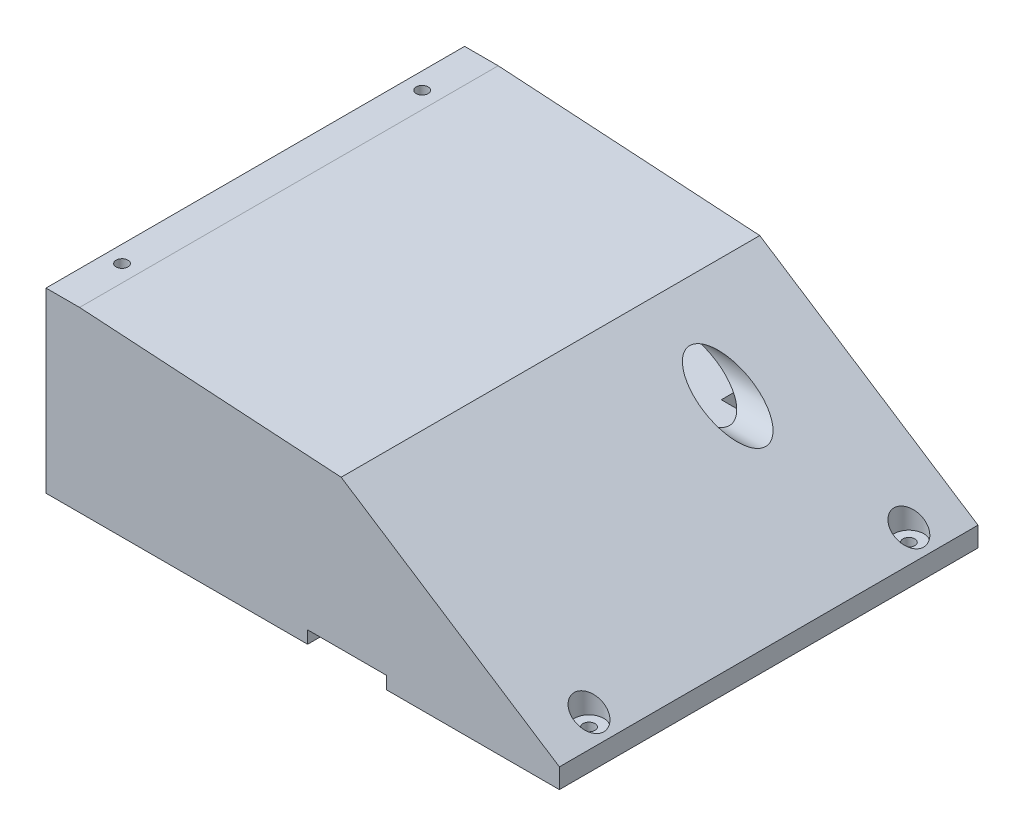
from build123d import *

# Parameters (mm, degrees)
BOSS_EXTRUDE1_DEPTH     = 212
BOSS_EXTRUDE2_DEPTH     = 10
BOSS_EXTRUDE3_DEPTH     = 10
SKETCH4_R               = 3
CUT_EXTRUDE1_DEPTH      = 348.338451658
SKETCH6_R               = 7.5
CUT_EXTRUDE2_DEPTH      = 345.882588717
SKETCH7_R               = 1.5
SKETCH7_R_2             = 12.5
SKETCH7_W               = 10
SKETCH7_H               = 120
SKETCH7_W_2             = 60
SKETCH7_H_2             = 15
CUT_EXTRUDE3_DEPTH      = 12.5
CUT_EXTRUDE4_REACH      = 276.574
SKETCH8_R               = 12.5
CUT_EXTRUDE5_DEPTH      = 342.714793358
CUT_EXTRUDE5_DEPTH_BACK = 342.714793358
SKETCH9_R               = 3
CUT_EXTRUDE6_DEPTH      = 348.338451658
CUT_EXTRUDE6_DEPTH_BACK = 348.338451658
SKETCH10_W              = 40
SKETCH10_H              = 6.35


with BuildPart() as part:
    # Sketch1 → Boss-Extrude1 (new body)
    with BuildSketch(Plane.XY):
        Polygon((0, 0), (-20, 0), (-20, 20), (-242.984559153, 20), (-242.984559153, 25), (-260, 25), (-260, 30), (-49.158083864, 30), (-122.301669645, 77.5), (-242.984559153, 85), (-260, 85), (-260, 90), (-242.984559153, 90), (-110.511971445, 81.767313396), (0, 10), align=None)
    extrude(amount=BOSS_EXTRUDE1_DEPTH)

    # Sketch2 → Boss-Extrude2 (add)
    with BuildSketch(Plane(origin=(0, 0, 0), x_dir=(-1, 0, 0), z_dir=(0, 0, -1))):
        Polygon((0, 0), (260, 0), (260, 90), (110.511971445, 81.767313396), (0, 10), align=None)
    extrude(amount=-BOSS_EXTRUDE2_DEPTH)

    # Sketch3 → Boss-Extrude3 (add)
    with BuildSketch(Plane.XY.offset(212)):
        Polygon((-110.511971445, 81.767313396), (0, 10), (0, 0), (-260, 0), (-260, 90), align=None)
    extrude(amount=-BOSS_EXTRUDE3_DEPTH)

    # Sketch4 → Cut-Extrude1 (cut, through all)
    with BuildSketch(Plane.XZ):
        with Locations((-10, 187)):
            Circle(SKETCH4_R)
        with Locations((-10, 25)):
            Circle(SKETCH4_R)
    extrude(amount=-CUT_EXTRUDE1_DEPTH, mode=Mode.SUBTRACT)

    # Sketch6 → Cut-Extrude2 (cut, through all)
    with BuildSketch(Plane(origin=(0, 10, 0), x_dir=(-1, 0, 0), z_dir=(0, -1, 0))):
        with Locations((10, -25)):
            Circle(SKETCH6_R)
        with Locations((10, -187)):
            Circle(SKETCH6_R)
    extrude(amount=-CUT_EXTRUDE2_DEPTH, mode=Mode.SUBTRACT)

    # Sketch7 → Cut-Extrude3 (cut)
    with BuildSketch(Plane.XZ.offset(-20)):
        with Locations((-161.484559153, 161)):
            Circle(SKETCH7_R)
        with Locations((-225.684559153, 161)):
            Circle(SKETCH7_R)
        with Locations((-161.484559153, 51)):
            Circle(SKETCH7_R)
        with Locations((-225.684559153, 51)):
            Circle(SKETCH7_R)
        with Locations((-67.984559153, 136)):
            Circle(SKETCH7_R_2)
        with Locations((-92.099111311, 106)):
            Rectangle(SKETCH7_W, SKETCH7_H)
        with Locations((-70, 22.5)):
            Rectangle(SKETCH7_W_2, SKETCH7_H_2)
    extrude(amount=-CUT_EXTRUDE3_DEPTH, mode=Mode.SUBTRACT)

    # Sketch8 → Cut-Extrude4 (cut, up to next)
    with BuildSketch(Plane.ZY.offset(110.511971445), mode=Mode.PRIVATE) as cut_extrude4_sk1:
        with Locations((54, 57.25)):
            Circle(SKETCH8_R)
    cut_extrude4_tool1 = extrude(cut_extrude4_sk1.sketch, amount=-CUT_EXTRUDE4_REACH, mode=Mode.PRIVATE) & part.part
    add(cut_extrude4_tool1.solids().sort_by_distance((-110.511971, 57.25, 54))[0], mode=Mode.SUBTRACT)

    # Sketch9 → Cut-Extrude5 (cut, two sides: drawn at the far end of the back side and taken through both)
    with BuildSketch(Plane.XZ.offset(-25).offset(-CUT_EXTRUDE5_DEPTH_BACK)):
        with Locations((-251.5, 182)):
            Circle(SKETCH9_R)
        with Locations((-251.5, 30)):
            Circle(SKETCH9_R)
    extrude(amount=CUT_EXTRUDE5_DEPTH + CUT_EXTRUDE5_DEPTH_BACK, mode=Mode.SUBTRACT)

    # Sketch10 → Cut-Extrude6 (cut, two sides: drawn at the far end of the back side and taken through both)
    with BuildSketch(Plane.XY.offset(212).offset(-CUT_EXTRUDE6_DEPTH_BACK)):
        with Locations((-107.5, 3.175)):
            Rectangle(SKETCH10_W, SKETCH10_H)
    extrude(amount=CUT_EXTRUDE6_DEPTH + CUT_EXTRUDE6_DEPTH_BACK, mode=Mode.SUBTRACT)


solid = part.part
